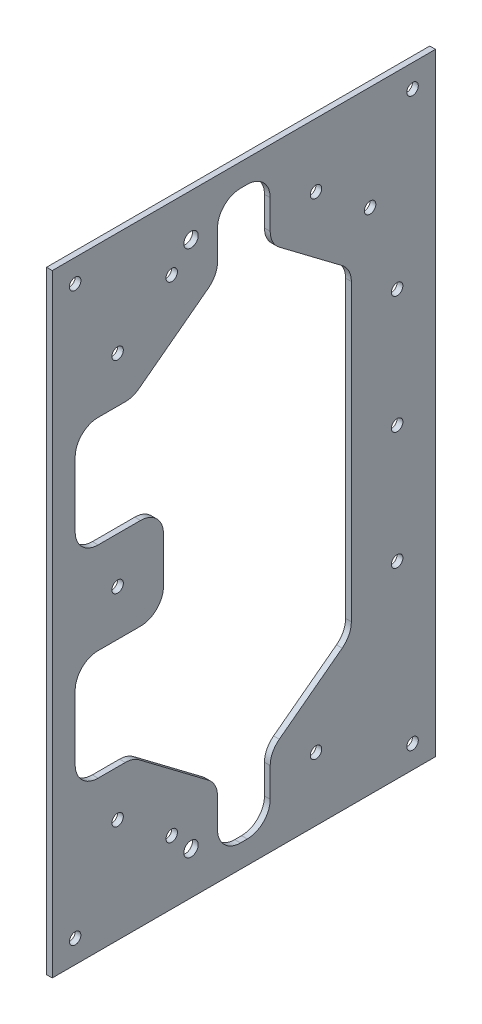
from build123d import *

# Parameters (mm, degrees)
SKETCH1_W           = 212.5
SKETCH1_H           = 339.725
SKETCH1_R           = 3.175
BOSS_EXTRUDE1_DEPTH = 3.175
CUT_EXTRUDE1_DEPTH  = 401.72360331
SKETCH3_R           = 4
CUT_EXTRUDE2_DEPTH  = 45.72
SKETCH4_R           = 4
CUT_EXTRUDE3_DEPTH  = 14.986


with BuildPart() as part:
    # Sketch1 → Boss-Extrude1 (new body)
    with BuildSketch(Plane(origin=(0, 0, 0), x_dir=(0, 0, -1), z_dir=(1, 0, 0))):
        with Locations((106.25, -169.8625)):
            Rectangle(SKETCH1_W, SKETCH1_H)
        with Locations((12.7, -12.7)):
            Circle(SKETCH1_R, mode=Mode.SUBTRACT)
        with Locations((199.8, -12.7)):
            Circle(SKETCH1_R, mode=Mode.SUBTRACT)
        with Locations((66.25, -35.2425)):
            Circle(SKETCH1_R, mode=Mode.SUBTRACT)
        with Locations((146.25, -35.2425)):
            Circle(SKETCH1_R, mode=Mode.SUBTRACT)
        with Locations((176.25, -57.8625)):
            Circle(SKETCH1_R, mode=Mode.SUBTRACT)
        with Locations((36.25, -57.8625)):
            Circle(SKETCH1_R, mode=Mode.SUBTRACT)
        with Locations((191.25, -104.5325)):
            Circle(SKETCH1_R, mode=Mode.SUBTRACT)
        with Locations((36.25, -169.8625)):
            Circle(SKETCH1_R, mode=Mode.SUBTRACT)
        with Locations((191.25, -169.8625)):
            Circle(SKETCH1_R, mode=Mode.SUBTRACT)
        with Locations((36.25, -281.8625)):
            Circle(SKETCH1_R, mode=Mode.SUBTRACT)
        with Locations((66.25, -304.4825)):
            Circle(SKETCH1_R, mode=Mode.SUBTRACT)
        with Locations((12.7, -327.025)):
            Circle(SKETCH1_R, mode=Mode.SUBTRACT)
        with Locations((199.8, -327.025)):
            Circle(SKETCH1_R, mode=Mode.SUBTRACT)
        with Locations((146.25, -304.4825)):
            Circle(SKETCH1_R, mode=Mode.SUBTRACT)
        with Locations((191.25, -235.1925)):
            Circle(SKETCH1_R, mode=Mode.SUBTRACT)
    extrude(amount=BOSS_EXTRUDE1_DEPTH)

    # Sketch2 → Cut-Extrude1 (cut, through all)
    with BuildSketch(Plane(origin=(3.175, 0, 0), x_dir=(0, 0, -1), z_dir=(1, 0, 0))):
        with BuildLine():
            Line((165.85, -251.563304242), (165.85, -88.161695758))
            ThreePointArc((165.85, -88.161695758), (164.516472011, -82.49659964), (160.795934799, -78.021198677))
            Line((160.795934799, -78.021198677), (125.904065201, -51.712729))
            ThreePointArc((125.904065201, -51.712729), (122.183527989, -47.237328037), (120.85, -41.572231919))
            Line((120.85, -41.572231919), (120.85, -25.4))
            ThreePointArc((120.85, -25.4), (117.130256121, -16.419743879), (108.15, -12.7))
            Line((108.15, -12.7), (104.35, -12.7))
            ThreePointArc((104.35, -12.7), (95.369743879, -16.419743879), (91.65, -25.4))
            Line((91.65, -25.4), (91.65, -41.572231919))
            ThreePointArc((91.65, -41.572231919), (90.316472011, -47.237328037), (86.595934799, -51.712729))
            Line((86.595934799, -51.712729), (61.65, -70.521963839))
            Line((61.65, -70.521963839), (48.147303392, -80.702997081))
            ThreePointArc((48.147303392, -80.702997081), (44.532850149, -82.605637318), (40.501368593, -83.2625))
            Line((40.501368593, -83.2625), (25.4, -83.2625))
            ThreePointArc((25.4, -83.2625), (16.419743879, -86.982243879), (12.7, -95.9625))
            Line((12.7, -95.9625), (12.7, -131.7625))
            ThreePointArc((12.7, -131.7625), (16.419743879, -140.742756121), (25.4, -144.4625))
            Line((25.4, -144.4625), (48.95, -144.4625))
            ThreePointArc((48.95, -144.4625), (57.930256121, -148.182243879), (61.65, -157.1625))
            Line((61.65, -157.1625), (61.65, -182.5625))
            ThreePointArc((61.65, -182.5625), (57.930256121, -191.542756121), (48.95, -195.2625))
            Line((48.95, -195.2625), (25.4, -195.2625))
            ThreePointArc((25.4, -195.2625), (16.419743879, -198.982243879), (12.7, -207.9625))
            Line((12.7, -207.9625), (12.7, -243.7625))
            ThreePointArc((12.7, -243.7625), (16.419743879, -252.742756121), (25.4, -256.4625))
            Line((25.4, -256.4625), (40.501368593, -256.4625))
            ThreePointArc((40.501368593, -256.4625), (44.532850149, -257.119362682), (48.147303392, -259.022002919))
            Line((48.147303392, -259.022002919), (61.65, -269.203036161))
            Line((61.65, -269.203036161), (86.595934799, -288.012271))
            ThreePointArc((86.595934799, -288.012271), (90.316472011, -292.487671963), (91.65, -298.152768081))
            Line((91.65, -298.152768081), (91.65, -314.325))
            ThreePointArc((91.65, -314.325), (95.369743879, -323.305256121), (104.35, -327.025))
            Line((104.35, -327.025), (108.15, -327.025))
            ThreePointArc((108.15, -327.025), (117.130256121, -323.305256121), (120.85, -314.325))
            Line((120.85, -314.325), (120.85, -298.152768081))
            ThreePointArc((120.85, -298.152768081), (122.183527989, -292.487671963), (125.904065201, -288.012271))
            Line((125.904065201, -288.012271), (160.795934799, -261.703801323))
            ThreePointArc((160.795934799, -261.703801323), (164.516472011, -257.22840036), (165.85, -251.563304242))
        make_face()
    extrude(amount=-CUT_EXTRUDE1_DEPTH, mode=Mode.SUBTRACT)

    # Sketch3 → Cut-Extrude2 (cut)
    with BuildSketch(Plane.ZY):
        with Locations((-76.95, -316.111459893)):
            Circle(SKETCH3_R)
    extrude(amount=-CUT_EXTRUDE2_DEPTH, mode=Mode.SUBTRACT)

    # Sketch4 → Cut-Extrude3 (cut)
    with BuildSketch(Plane.ZY):
        with Locations((-76.9625, -23.613540107)):
            Circle(SKETCH4_R)
    extrude(amount=-CUT_EXTRUDE3_DEPTH, mode=Mode.SUBTRACT)


solid = part.part
